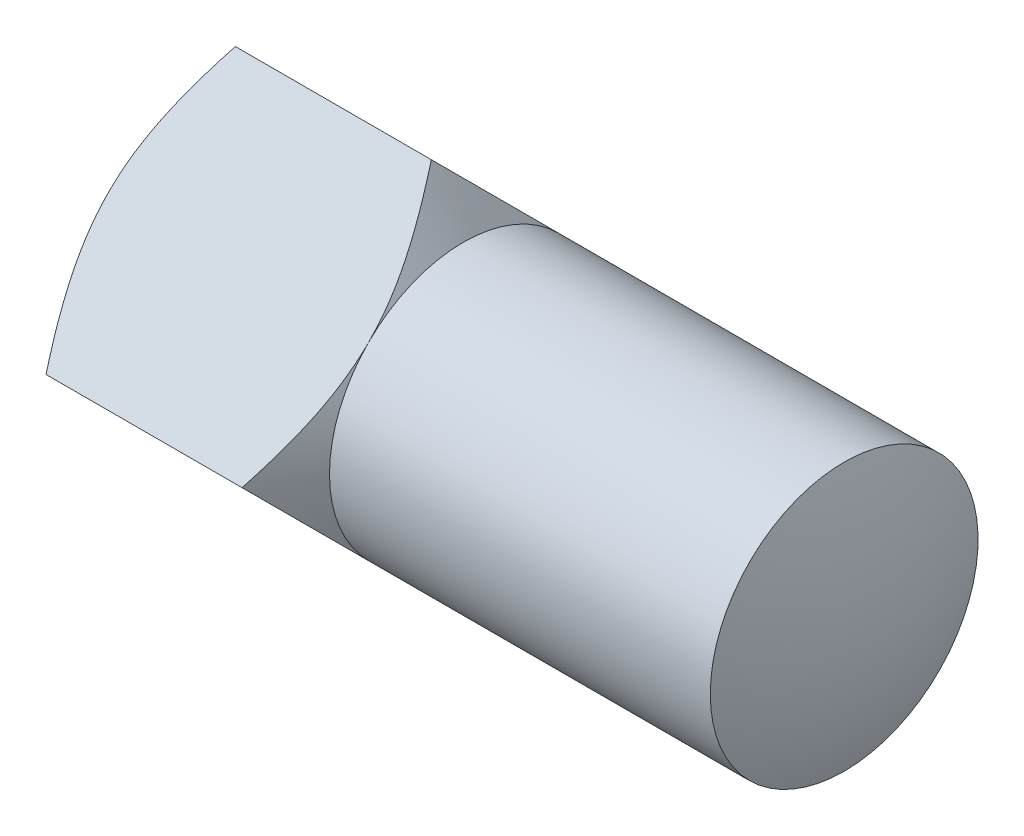
from build123d import *

# Parameters (mm, degrees)
BASEHEAD_DEPTH = 4


with BuildPart() as part:
    # BaseHeadSke → BaseHead (new body)
    with BuildSketch(Plane(origin=(0, 0, 0), x_dir=(0, 0, -1), z_dir=(1, 0, 0))):
        Polygon((0, 2.828427125), (2.828427125, 0), (0, -2.828427125), (-2.828427125, 0), align=None)
    extrude(amount=BASEHEAD_DEPTH)

    # HeadChamferSke → HeadChamfer (revolve, cut)
    with BuildSketch(Plane.XY):
        Polygon((0, 2.828427125), (0, 1.9), (0.53602765, 2.828427125), align=None)
        Polygon((3.46397235, 2.828427125), (4, 1.9), (4, 2.828427125), align=None)
    revolve(axis=Axis((0, 0, 0), (1, 0, 0)), mode=Mode.SUBTRACT)

    # BodySke → BaseBody (revolve)
    with BuildSketch(Plane.XY):
        with BuildLine():
            Line((3.46397235, 2), (9.630678732, 2))
            ThreePointArc((9.630678732, 2), (9.906895718, 1.016906854), (10, 0))
            Line((10, 0), (3.46397235, 0))
            Line((3.46397235, 0), (3.46397235, 2))
        make_face()
    revolve(axis=Axis((0, 0, 0), (1, 0, 0)))


solid = part.part
